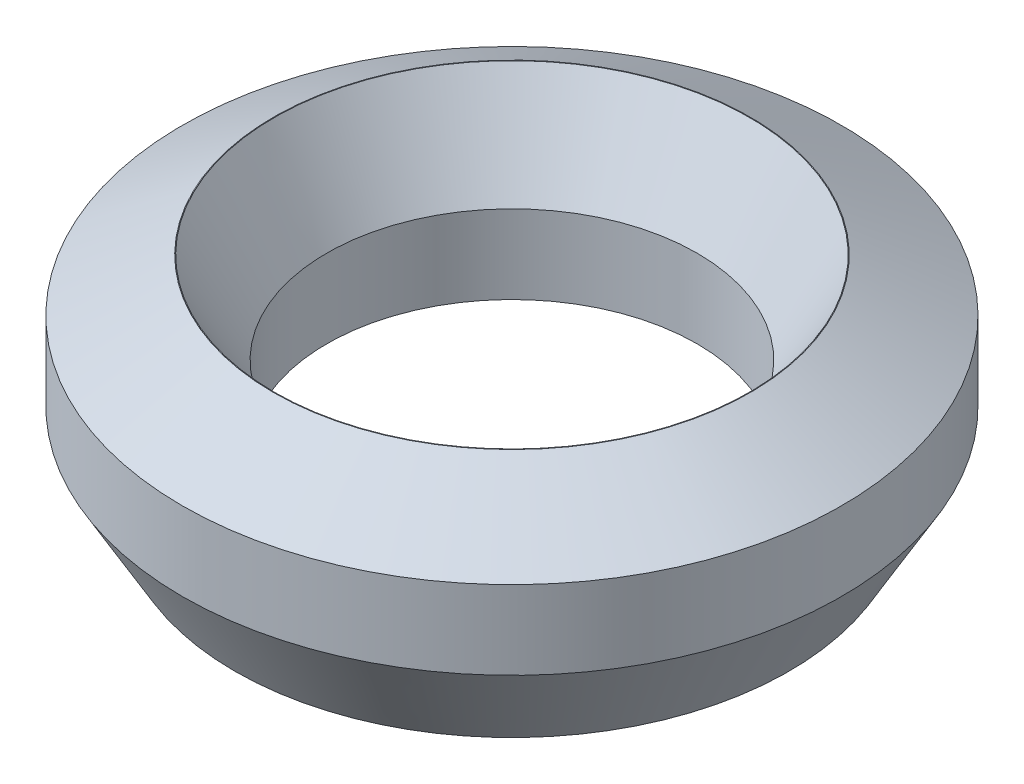
from build123d import *
from OCP.BRepFilletAPI import BRepFilletAPI_MakeChamfer

# Parameters (mm, degrees)
SKETCH1_R           = 17.5
BOSS_EXTRUDE1_DEPTH = 11.801039947
SKETCH2_R           = 9.832948248
CUT_EXTRUDE1_DEPTH  = 28.418324964
CHAMFER1_SIZE       = 2.792794237
CHAMFER1_SIZE2      = 4.837261513


with BuildPart() as part:
    # Sketch1 → Boss-Extrude1 (new body)
    with BuildSketch(Plane(origin=(0, 0, 0), x_dir=(1, 0, 0), z_dir=(0, 1, 0))):
        Circle(SKETCH1_R)
    extrude(amount=BOSS_EXTRUDE1_DEPTH)

    # Sketch2 → Cut-Extrude1 (cut, through all)
    with BuildSketch(Plane(origin=(0, 0, 0), x_dir=(1, 0, 0), z_dir=(0, 1, 0))):
        Circle(SKETCH2_R)
    extrude(amount=CUT_EXTRUDE1_DEPTH, mode=Mode.SUBTRACT)

    # Chamfer1: one chamfer whose edges measure the first distance from different faces: ONE call of the kernel's chamfer builder (chamfer() names one face for all edges)
    chamfer1_edges_1 = [part.edges().sort_by_distance(p)[0] for p in [
        (-9.832948248, 11.801039947, 0),
    ]]
    chamfer1_side_1 = [part.faces().sort_by_distance(p)[0] for p in [
        (-17.005025253, 11.801039947, 0),
    ]]
    chamfer1_edges_2 = [part.edges().sort_by_distance(p)[0] for p in [
        (-9.832948248, 0, 0),
    ]]
    chamfer1_side_2 = [part.faces().sort_by_distance(p)[0] for p in [
        (-9.832948248, 5.900519973, 0),
    ]]
    chamfer1_edges_3 = [part.edges().sort_by_distance(p)[0] for p in [
        (-17.5, 0, 0),
    ]]
    chamfer1_side_3 = [part.faces().sort_by_distance(p)[0] for p in [
        (-17.005025253, 0, 0),
    ]]
    chamfer1_edges_4 = [part.edges().sort_by_distance(p)[0] for p in [
        (-17.5, 11.801039947, 0),
    ]]
    chamfer1_side_4 = [part.faces().sort_by_distance(p)[0] for p in [
        (-17.5, 5.900519973, 0),
    ]]
    chamfer1 = BRepFilletAPI_MakeChamfer(part.part.solid().wrapped)
    for e in chamfer1_edges_1:
        chamfer1.Add(CHAMFER1_SIZE, CHAMFER1_SIZE2, e.wrapped, chamfer1_side_1[0].wrapped)  # the first distance lies on this face
    for e in chamfer1_edges_2:
        chamfer1.Add(CHAMFER1_SIZE, CHAMFER1_SIZE2, e.wrapped, chamfer1_side_2[0].wrapped)  # the first distance lies on this face
    for e in chamfer1_edges_3:
        chamfer1.Add(CHAMFER1_SIZE, CHAMFER1_SIZE2, e.wrapped, chamfer1_side_3[0].wrapped)  # the first distance lies on this face
    for e in chamfer1_edges_4:
        chamfer1.Add(CHAMFER1_SIZE, CHAMFER1_SIZE2, e.wrapped, chamfer1_side_4[0].wrapped)  # the first distance lies on this face
    add(Compound.cast(chamfer1.Shape()), mode=Mode.REPLACE)


solid = part.part
